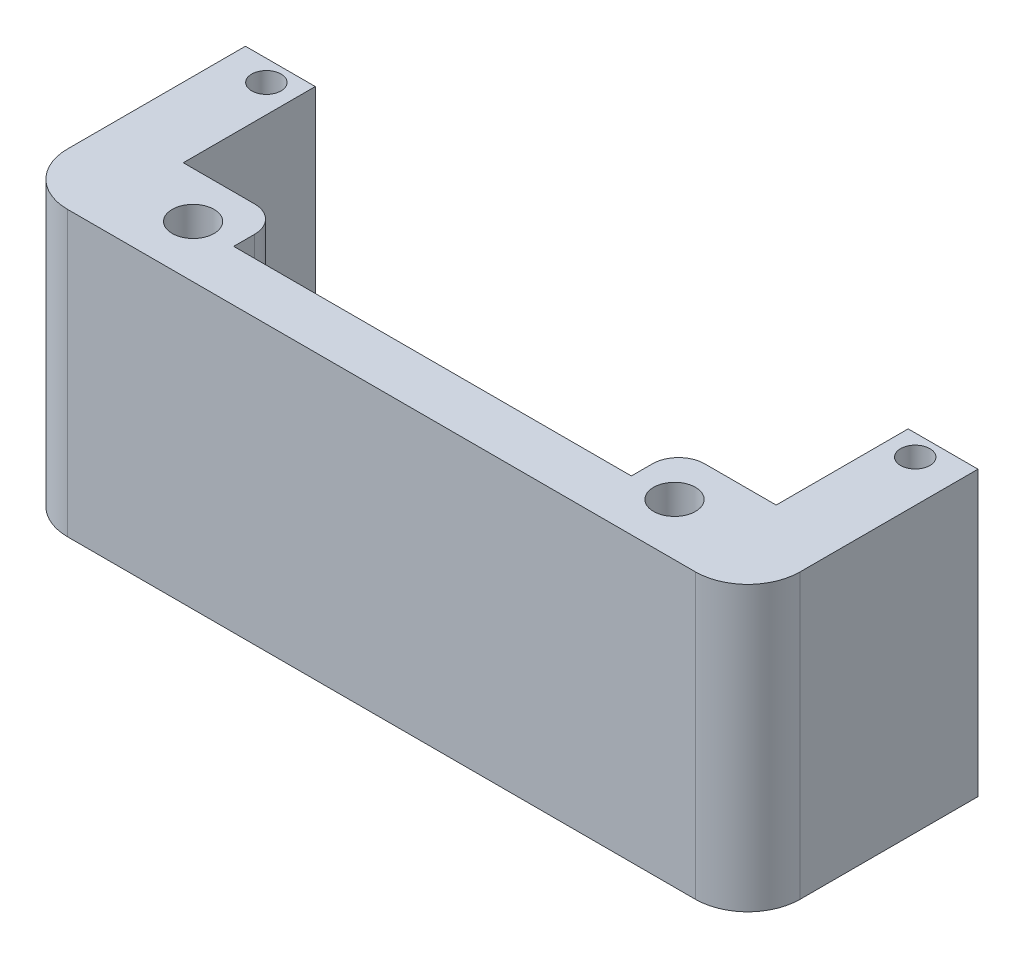
from build123d import *

# Parameters (mm, degrees)
BOSS_EXTRUDE1_DEPTH = 54.2
FILLET1_R           = 10
CUT_EXTRUDE1_DEPTH  = 54.2
SKETCH4_W           = 18.65464249
SKETCH4_H           = 25.226044385
CUT_EXTRUDE2_DEPTH  = 54.2
FILLET3_R           = 5
SKETCH5_R           = 2.8
SKETCH5_R_2         = 2.799999999
CUT_EXTRUDE3_DEPTH  = 93.837303189


with BuildPart() as part:
    # Sketch1 → Boss-Extrude1 (new body)
    with BuildSketch(Plane(origin=(0, 0, 0), x_dir=(1, 0, 0), z_dir=(0, 1, 0))):
        with BuildLine():
            Line((-70, -16.051389428), (70, -16.051389428))
            Line((70, -16.051389428), (70, 27.948610572))
            Line((70, 27.948610572), (38, 27.948610572))
            Line((38, 27.948610572), (38, -6.301389428))
            add(Edge.make_bspline(
                [(38, -6.301389428), (37.471746795, -6.314820396), (36.926393757, -6.301389428)],
                knots=[0.97238422, 0.97238422, 0.97238422, 1, 1, 1], degree=2))
            Line((36.926393757, -6.301389428), (-38, -6.301389428))
            Line((-38, -6.301389428), (-38, 27.948610572))
            Line((-38, 27.948610572), (-70, 27.948610572))
            Line((-70, 27.948610572), (-70, -16.051389428))
        make_face()
    extrude(amount=BOSS_EXTRUDE1_DEPTH)

    # Fillet1
    fillet1_edges = [part.edges().sort_by_distance(p)[0] for p in [
        (70, 27.1, 16.051389428),
        (-70, 27.1, 16.051389428),
    ]]
    fillet(fillet1_edges, radius=FILLET1_R)

    # Sketch2 → Cut-Extrude1 (cut)
    with BuildSketch(Plane(origin=(0, 54.2, 0), x_dir=(1, 0, 0), z_dir=(0, 1, 0))):
        with BuildLine():
            add(Edge.make_bspline(
                [(62, 25.948610572), (58, 25.948610572), (58, 21.948610572), (62, 21.948610572), (66, 21.948610572), (66, 25.948610572), (62, 25.948610572)],
                knots=[0, 0, 0, 0, 0.5, 0.5, 0.5, 1, 1, 1, 1], degree=3, weights=[1, 0.333333333, 0.333333333, 1, 0.333333333, 0.333333333, 1]))
        make_face()
        with BuildLine():
            add(Edge.make_bspline(
                [(45.997192973, -10.051388443), (53.997191003, -10.057002497), (54.002805057, -2.057004467), (46.002807027, -2.051390412), (38.002808997, -2.045776358), (37.997194943, -10.045774389), (45.997192973, -10.051388443)],
                knots=[0, 0, 0, 0, 0.5, 0.5, 0.5, 1, 1, 1, 1], degree=3, weights=[1, 0.333333333, 0.333333333, 1, 0.333333333, 0.333333333, 1]))
        make_face()
        with BuildLine():
            add(Edge.make_bspline(
                [(-49.999999015, -6.0485824), (-50.005613069, -14.048580431), (-42.005615039, -14.054194485), (-42.000000985, -6.054196455), (-41.994386931, 1.945801576), (-49.994384961, 1.95141563), (-49.999999015, -6.0485824)],
                knots=[0, 0, 0, 0, 0.5, 0.5, 0.5, 1, 1, 1, 1], degree=3, weights=[1, 0.333333333, 0.333333333, 1, 0.333333333, 0.333333333, 1]))
        make_face()
        with BuildLine():
            add(Edge.make_bspline(
                [(-62, 21.948610572), (-58, 21.948610572), (-58, 25.948610572), (-62, 25.948610572), (-66, 25.948610572), (-66, 21.948610572), (-62, 21.948610572)],
                knots=[0, 0, 0, 0, 0.5, 0.5, 0.5, 1, 1, 1, 1], degree=3, weights=[1, 0.333333333, 0.333333333, 1, 0.333333333, 0.333333333, 1]))
        make_face()
    extrude(amount=-CUT_EXTRUDE1_DEPTH, mode=Mode.SUBTRACT)

    # Sketch4 → Cut-Extrude2 (cut)
    with BuildSketch(Plane(origin=(0, 54.2, 0), x_dir=(1, 0, 0), z_dir=(0, 1, 0))):
        with Locations((47.327321245, 15.33558838)):
            Rectangle(SKETCH4_W, SKETCH4_H)
        with Locations((-47.327321245, 15.33558838)):
            Rectangle(SKETCH4_W, SKETCH4_H)
    extrude(amount=-CUT_EXTRUDE2_DEPTH, mode=Mode.SUBTRACT)

    # Fillet3
    fillet3_edges = [part.edges().sort_by_distance(p)[0] for p in [
        (38, 27.1, -2.722566187),
        (-38, 27.1, -2.722566187),
    ]]
    fillet(fillet3_edges, radius=FILLET3_R)

    # Sketch5 → Cut-Extrude3 (cut, through all)
    with BuildSketch(Plane(origin=(0, 54.2, 0), x_dir=(1, 0, 0), z_dir=(0, 1, 0))):
        with Locations((-62, 23.948610572)):
            Circle(SKETCH5_R)
        with Locations((62, 23.948610572)):
            Circle(SKETCH5_R_2)
    extrude(amount=-CUT_EXTRUDE3_DEPTH, mode=Mode.SUBTRACT)


solid = part.part
